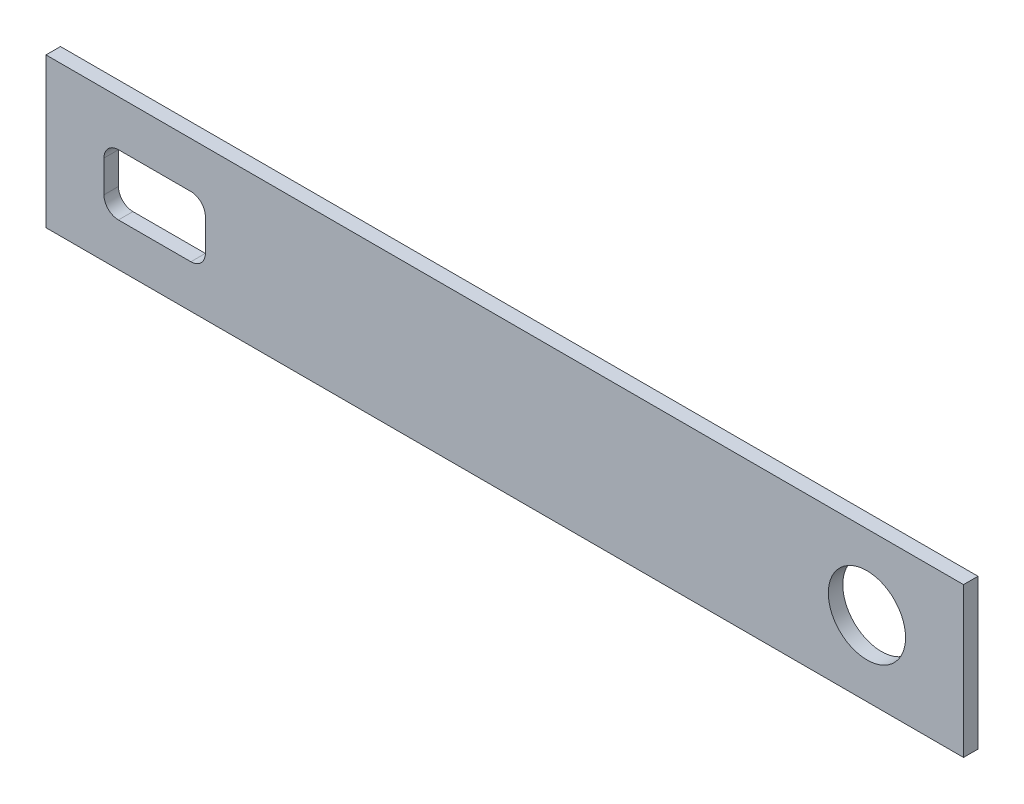
from build123d import *

# Parameters (mm, degrees)
SKETCH1_W          = 190
SKETCH1_H          = 31
SKETCH1_R          = 8
BASE_FLANGE1_DEPTH = 3


# Sheet-metal steps are written as plain solids
with BuildPart() as part:
    # Sketch1 → Base-Flange1 (new body)
    with BuildSketch(Plane.XY):
        with Locations((95, 15.5)):
            Rectangle(SKETCH1_W, SKETCH1_H)
        with Locations((170, 15.5)):
            Circle(SKETCH1_R, mode=Mode.SUBTRACT)
        with BuildLine():
            Line((15, 21.5), (30, 21.5))
            ThreePointArc((30, 21.5), (32.121320344, 20.621320344), (33, 18.5))
            Line((33, 18.5), (33, 11.9))
            ThreePointArc((33, 11.9), (32.121320344, 9.778679656), (30, 8.9))
            Line((30, 8.9), (15, 8.9))
            ThreePointArc((15, 8.9), (12.878679656, 9.778679656), (12, 11.9))
            Line((12, 11.9), (12, 18.5))
            ThreePointArc((12, 18.5), (12.878679656, 20.621320344), (15, 21.5))
        make_face(mode=Mode.SUBTRACT)
    extrude(amount=-BASE_FLANGE1_DEPTH)


solid = part.part
